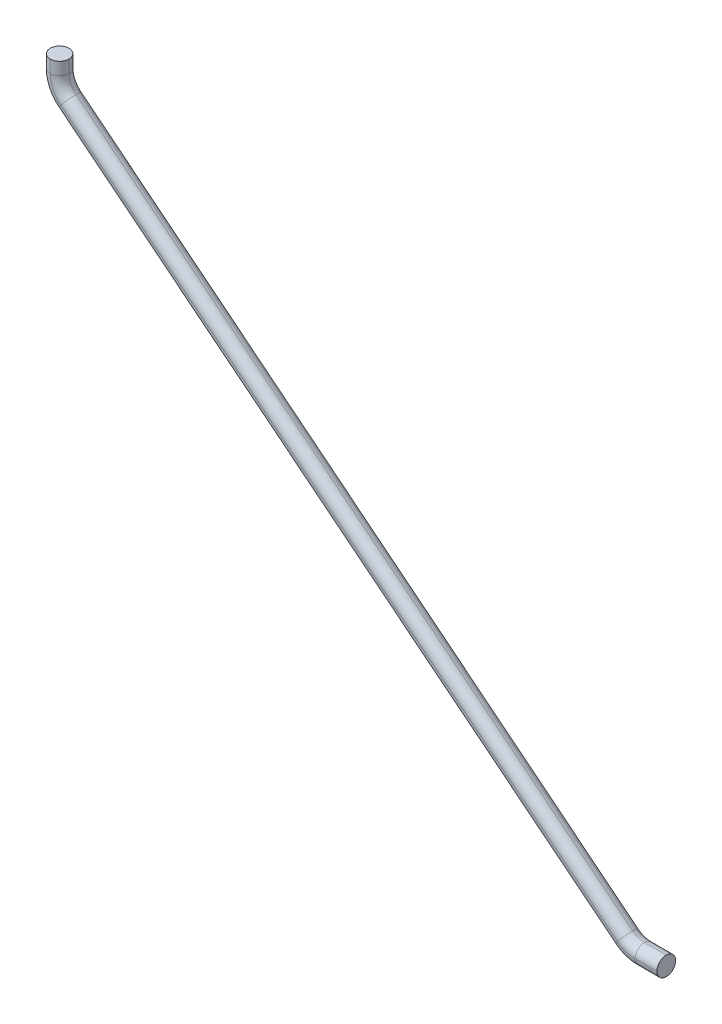
from build123d import *

# Parameters (mm, degrees)
BOSS_EXTRUDE1_DEPTH      = 10
BOSS_EXTRUDE1_DEPTH_BACK = 10
FILLET1_R                = 10


with BuildPart() as part:
    # Sketch1 → Boss-Extrude1 (new, two sides: drawn at the far end of the back side and taken through both)
    with BuildSketch(Plane.XY.offset(-BOSS_EXTRUDE1_DEPTH_BACK)):
        with BuildLine():
            Line((237.926881338, -1499.570637215), (237.926881338, -1519.570637215))
            Line((237.926881338, -1519.570637215), (214.725572022, -1519.570637215))
            ThreePointArc((214.725572022, -1519.570637215), (201.473903455, -1517.311772335), (189.718921324, -1510.790301224))
            Line((189.718921324, -1510.790301224), (-403.542618158, -1035.59351223))
            ThreePointArc((-403.542618158, -1035.59351223), (-414.593324739, -1021.690516088), (-418.53596746, -1004.37384822))
            Line((-418.53596746, -1004.37384822), (-418.53596746, -990.945694684))
            Line((-418.53596746, -990.945694684), (-398.53596746, -990.945694684))
            Line((-398.53596746, -990.945694684), (-398.53596746, -1004.37384822))
            ThreePointArc((-398.53596746, -1004.37384822), (-396.5646461, -1013.032182154), (-391.039292809, -1019.983680225))
            Line((-391.039292809, -1019.983680225), (202.222246673, -1495.180469219))
            ThreePointArc((202.222246673, -1495.180469219), (208.099737738, -1498.441204775), (214.725572022, -1499.570637215))
            Line((214.725572022, -1499.570637215), (237.926881338, -1499.570637215))
        make_face()
    extrude(amount=BOSS_EXTRUDE1_DEPTH + BOSS_EXTRUDE1_DEPTH_BACK)

    # Fillet1
    fillet1_edges = [part.edges().sort_by_distance(p)[0] for p in [
        (226.32622668, -1499.570637215, -10),
        (208.099737738, -1498.441204775, -10),
        (-398.53596746, -997.659771452, -10),
        (-396.5646461, -1013.032182154, -10),
        (-418.53596746, -997.659771452, -10),
        (-414.593324739, -1021.690516088, -10),
        (226.32622668, -1519.570637215, -10),
        (201.473903455, -1517.311772335, -10),
        (226.32622668, -1499.570637215, 10),
        (208.099737738, -1498.441204775, 10),
        (-398.53596746, -997.659771452, 10),
        (-396.5646461, -1013.032182154, 10),
        (-418.53596746, -997.659771452, 10),
        (-414.593324739, -1021.690516088, 10),
        (226.32622668, -1519.570637215, 10),
        (201.473903455, -1517.311772335, 10),
        (-94.408523068, -1257.582074722, -10),
        (-106.911848417, -1273.191906727, -10),
        (-94.408523068, -1257.582074722, 10),
        (-106.911848417, -1273.191906727, 10),
    ]]
    fillet(fillet1_edges, radius=FILLET1_R - 0.0001)  # a hair under: the kernel refuses the full size


solid = part.part
